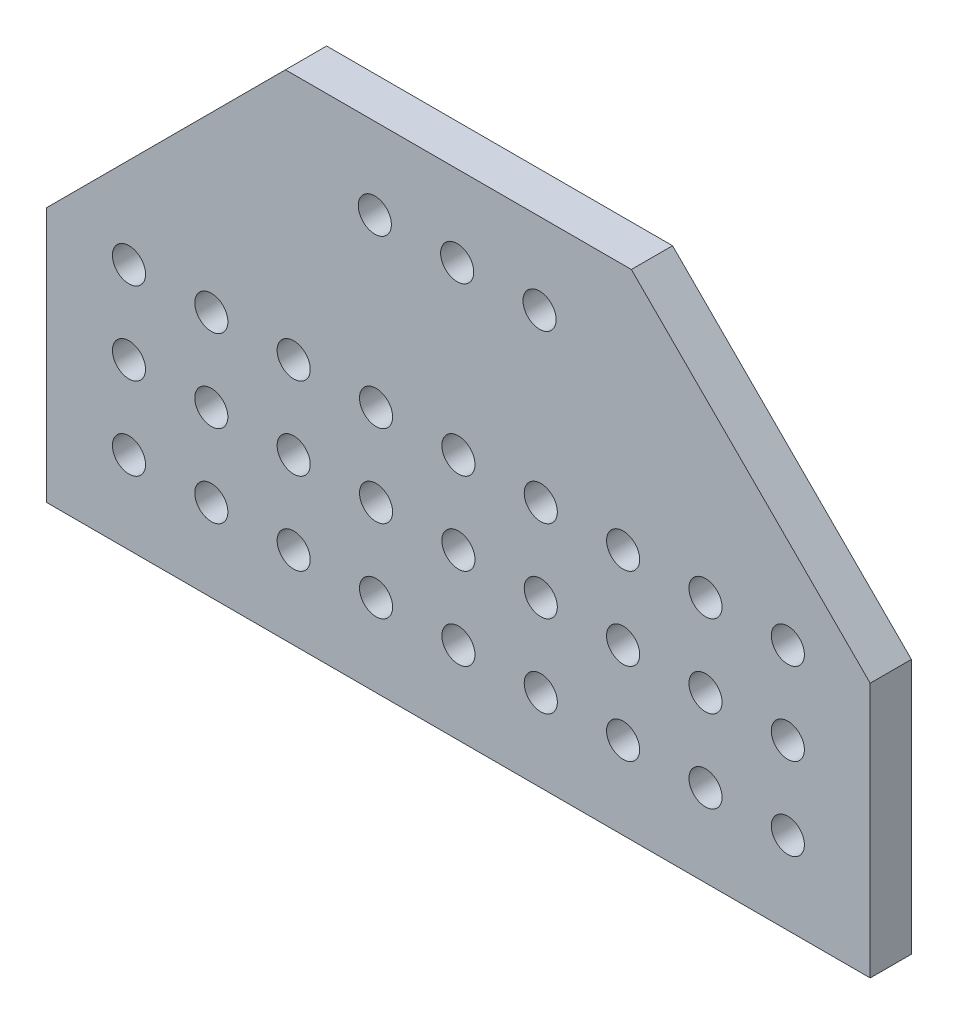
from build123d import *

# Parameters (mm, degrees)
SKETCH1_W               = 127
SKETCH1_H               = 82.55
BOSS_EXTRUDE1_DEPTH     = 6.35
CUT_EXTRUDE1_DEPTH      = 152.604172106
CUT_EXTRUDE1_DEPTH_BACK = 152.604172106
SKETCH2_R               = 2.5527
SKETCH3_R               = 2.5527
CUT_EXTRUDE2_DEPTH      = 152.604172106
CUT_EXTRUDE3_DEPTH      = 152.604172106
CUT_EXTRUDE4_DEPTH      = 152.604172106


with BuildPart() as part:
    # Sketch1 → Boss-Extrude1 (new body)
    with BuildSketch(Plane.XY):
        with Locations((63.5, 41.275)):
            Rectangle(SKETCH1_W, SKETCH1_H)
    extrude(amount=BOSS_EXTRUDE1_DEPTH)

    # Sketch2 → Cut-Extrude1 (cut, two sides: drawn at the far end of the back side and taken through both)
    with BuildSketch(Plane(origin=(0, 0, 0), x_dir=(-1, 0, 0), z_dir=(0, 0, -1)).offset(-CUT_EXTRUDE1_DEPTH_BACK)):
        with Locations((-76.0095, 63.6905)):
            Circle(SKETCH2_R)
        with Locations((-63.3095, 63.6905)):
            Circle(SKETCH2_R)
        with Locations((-50.6095, 63.6905)):
            Circle(SKETCH2_R)
    extrude(amount=CUT_EXTRUDE1_DEPTH + CUT_EXTRUDE1_DEPTH_BACK, mode=Mode.SUBTRACT)

    # Sketch3 → Cut-Extrude2 (cut, through all)
    with BuildSketch(Plane(origin=(0, 0, 0), x_dir=(-1, 0, 0), z_dir=(0, 0, -1))):
        with Locations((-114.3, 38.1)):
            Circle(SKETCH3_R)
        with Locations((-114.3, 25.4)):
            Circle(SKETCH3_R)
        with Locations((-114.3, 12.7)):
            Circle(SKETCH3_R)
        with Locations((-101.6, 38.1)):
            Circle(SKETCH3_R)
        with Locations((-101.6, 25.4)):
            Circle(SKETCH3_R)
        with Locations((-101.6, 12.7)):
            Circle(SKETCH3_R)
        with Locations((-88.9, 38.1)):
            Circle(SKETCH3_R)
        with Locations((-88.9, 25.4)):
            Circle(SKETCH3_R)
        with Locations((-88.9, 12.7)):
            Circle(SKETCH3_R)
        with Locations((-76.2, 38.1)):
            Circle(SKETCH3_R)
        with Locations((-76.2, 25.4)):
            Circle(SKETCH3_R)
        with Locations((-76.2, 12.7)):
            Circle(SKETCH3_R)
        with Locations((-63.5, 38.1)):
            Circle(SKETCH3_R)
        with Locations((-63.5, 25.4)):
            Circle(SKETCH3_R)
        with Locations((-63.5, 12.7)):
            Circle(SKETCH3_R)
        with Locations((-50.8, 38.1)):
            Circle(SKETCH3_R)
        with Locations((-50.8, 25.4)):
            Circle(SKETCH3_R)
        with Locations((-50.8, 12.7)):
            Circle(SKETCH3_R)
        with Locations((-38.1, 38.1)):
            Circle(SKETCH3_R)
        with Locations((-38.1, 25.4)):
            Circle(SKETCH3_R)
        with Locations((-38.1, 12.7)):
            Circle(SKETCH3_R)
        with Locations((-25.4, 38.1)):
            Circle(SKETCH3_R)
        with Locations((-25.4, 25.4)):
            Circle(SKETCH3_R)
        with Locations((-25.4, 12.7)):
            Circle(SKETCH3_R)
        with Locations((-12.7, 38.1)):
            Circle(SKETCH3_R)
        with Locations((-12.7, 25.4)):
            Circle(SKETCH3_R)
        with Locations((-12.7, 12.7)):
            Circle(SKETCH3_R)
    extrude(amount=-CUT_EXTRUDE2_DEPTH, mode=Mode.SUBTRACT)

    # Sketch4 → Cut-Extrude3 (cut, through all)
    with BuildSketch(Plane(origin=(0, 0, 0), x_dir=(-1, 0, 0), z_dir=(0, 0, -1))):
        Polygon((-83.82, 82.55), (-127, 39.37), (-127, 82.55), align=None)
        Polygon((-43.18, 82.55), (0, 82.55), (0, 39.37), align=None)
    extrude(amount=-CUT_EXTRUDE3_DEPTH, mode=Mode.SUBTRACT)

    # Sketch5 → Cut-Extrude4 (cut, through all)
    with BuildSketch(Plane(origin=(0, 0, 0), x_dir=(-1, 0, 0), z_dir=(0, 0, -1))):
        Polygon((-90.17, 76.2), (-36.83, 76.2), (-43.18, 82.55), (-83.82, 82.55), align=None)
    extrude(amount=-CUT_EXTRUDE4_DEPTH, mode=Mode.SUBTRACT)


solid = part.part
